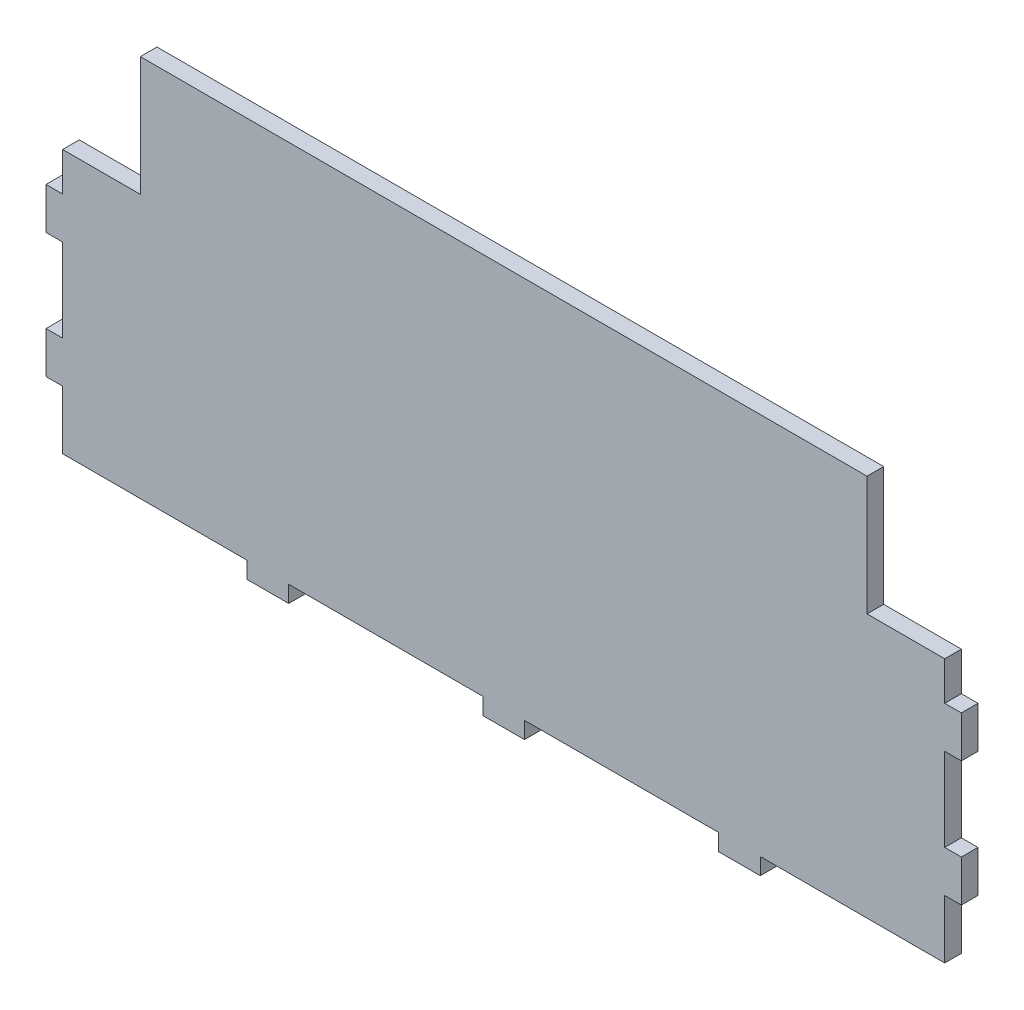
from build123d import *

# Parameters (mm, degrees)
BOSS_EXTRU_1_DEPTH = 6
ESQUISSE2_W        = 15
ESQUISSE2_H        = 6
ESQUISSE2_W_2      = 6
ESQUISSE2_H_2      = 15
BOSS_EXTRU_2_DEPTH = 6


with BuildPart() as part:
    # Esquisse1 → Boss.-Extru.1 (new body)
    with BuildSketch(Plane.XY):
        Polygon((-159, 37.446535043), (-131, 37.446535043), (-131, 80.446535043), (131, 80.446535043), (131, 37.446535043), (159, 37.446535043), (159, -57.553464957), (-159, -57.553464957), align=None)
    extrude(amount=BOSS_EXTRU_1_DEPTH)

    # Esquisse2 → Boss.-Extru.2 (add)
    with BuildSketch(Plane.XY.offset(6)):
        with Locations((-85, -60.553464957)):
            Rectangle(ESQUISSE2_W, ESQUISSE2_H)
        with Locations((0, -60.553464957)):
            Rectangle(ESQUISSE2_W, ESQUISSE2_H)
        with Locations((85, -60.553464957)):
            Rectangle(ESQUISSE2_W, ESQUISSE2_H)
        with Locations((-162, 16.036535043)):
            Rectangle(ESQUISSE2_W_2, ESQUISSE2_H_2)
        with Locations((-162, -28.963464957)):
            Rectangle(ESQUISSE2_W_2, ESQUISSE2_H_2)
        with Locations((162, -28.963464957)):
            Rectangle(ESQUISSE2_W_2, ESQUISSE2_H_2)
        with Locations((162, 16.036535043)):
            Rectangle(ESQUISSE2_W_2, ESQUISSE2_H_2)
    extrude(amount=-BOSS_EXTRU_2_DEPTH)


solid = part.part
